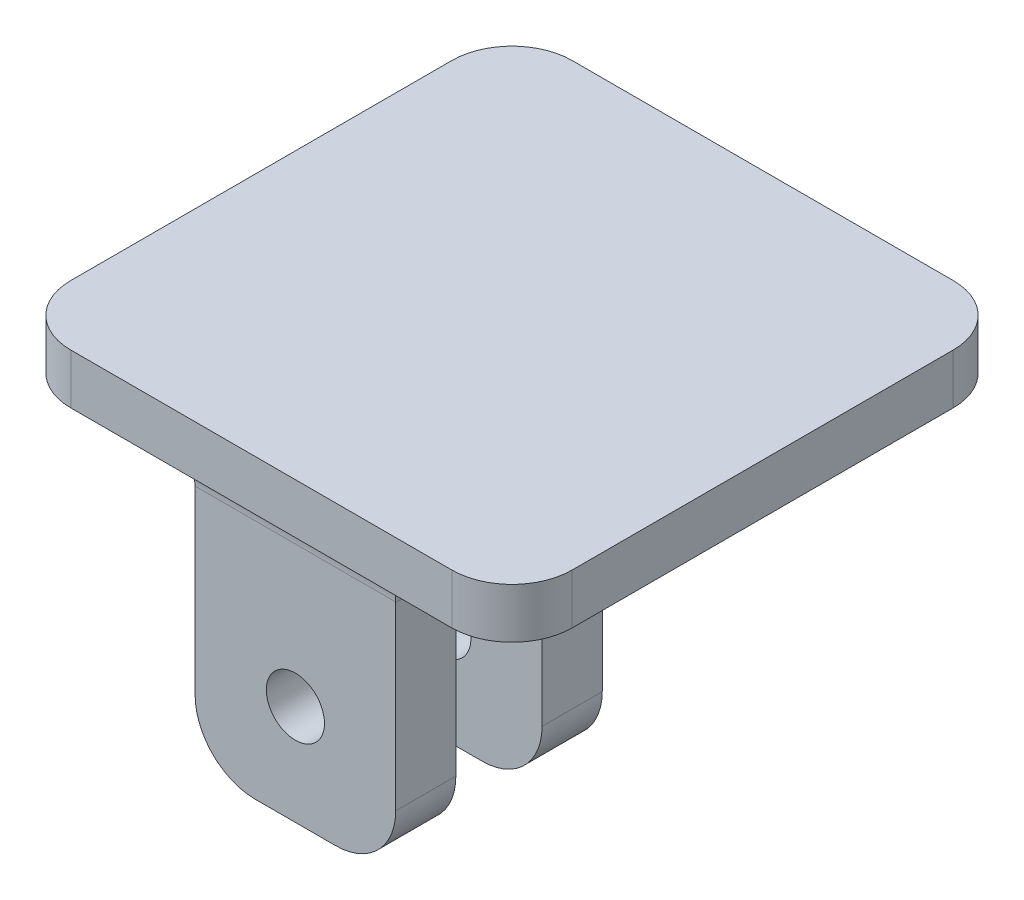
from build123d import *
from build123d.topology import SkipClean

# Parameters (mm, degrees)
SKETCH1_W           = 25
SKETCH1_H           = 25
BOSS_EXTRUDE1_DEPTH = 2.5
SKETCH2_W           = 10
SKETCH2_H           = 10.3
BOSS_EXTRUDE2_DEPTH = 14
SKETCH3_W           = 10
SKETCH3_H           = 4.3
CUT_EXTRUDE1_DEPTH  = 12
SKETCH4_R           = 1.45
CUT_EXTRUDE2_DEPTH  = 37.930881387
FILLET1_R           = 3
FILLET2_R           = 3
FILLET3_START       = -12
FILLET3_DEPTH       = 10.3
FILLET3_START_2     = -19.5000001
FILLET3_2_DEPTH     = 14.0000001
FILLET3_START_3     = -15
FILLET3_3_DEPTH     = 15.00001976


with BuildPart() as part:
    # Sketch1 → Boss-Extrude1 (new body)
    with BuildSketch(Plane(origin=(0, 0, 0), x_dir=(1, 0, 0), z_dir=(0, 1, 0))):
        with Locations((-12.5, 12.5)):
            Rectangle(SKETCH1_W, SKETCH1_H)
    extrude(amount=BOSS_EXTRUDE1_DEPTH)

    # Sketch2 → Boss-Extrude2 (add)
    with BuildSketch(Plane(origin=(0, 0, 0), x_dir=(-1, 0, 0), z_dir=(0, -1, 0))):
        with Locations((12.5, 6.85)):
            Rectangle(SKETCH2_W, SKETCH2_H)
    extrude(amount=BOSS_EXTRUDE2_DEPTH)

    # Sketch3 → Cut-Extrude1 (cut)
    with BuildSketch(Plane(origin=(0, -14, 0), x_dir=(-1, 0, 0), z_dir=(0, -1, 0))):
        with Locations((12.5, 6.85)):
            Rectangle(SKETCH3_W, SKETCH3_H)
    extrude(amount=-CUT_EXTRUDE1_DEPTH, mode=Mode.SUBTRACT)

    # Sketch4 → Cut-Extrude2 (cut, through all)
    with BuildSketch(Plane.XY.offset(-1.7)):
        with Locations((-12.5, -9)):
            Circle(SKETCH4_R)
    extrude(amount=-CUT_EXTRUDE2_DEPTH, mode=Mode.SUBTRACT)

    # Fillet1
    fillet1_edges = [part.edges().sort_by_distance(p)[0] for p in [
        (-17.5, -14, -3.2),
        (-7.5, -14, -10.5),
        (-17.5, -14, -10.5),
        (-7.5, -14, -3.2),
    ]]
    fillet(fillet1_edges, radius=FILLET1_R)

    # Fillet2
    fillet2_edges = [part.edges().sort_by_distance(p)[0] for p in [
        (0, 1.25, 0),
        (-25, 1.25, 0),
        (-25, 1.25, -25),
        (0, 1.25, -25),
    ]]
    fillet(fillet2_edges, radius=FILLET2_R)

    # Fillet3: read off the stored shape, not the designer's step
    # Fillet3 outline → Fillet3 (add)
    with BuildSketch(Plane.XY.offset(FILLET3_START)):
        with BuildLine():
            Line((-7.5, 0), (-7.5, -2))
            ThreePointArc((-7.5, -2), (-6.914213562, -0.585786438), (-5.5, 0))
            Line((-5.5, 0), (-7.5, 0))
        make_face()
        with BuildLine():
            Line((-17.5, -2), (-17.5, 0))
            Line((-17.5, 0), (-19.5, 0))
            ThreePointArc((-19.5, 0), (-18.085786438, -0.585786438), (-17.5, -2))
        make_face()
    extrude(amount=FILLET3_DEPTH)

    # Fillet3 2 outline → Fillet3 2 (add)
    with BuildSketch(Plane.YZ.offset(FILLET3_START_2)):
        with BuildLine():
            Line((0, -1.7), (1.1224e-05, 7.3987e-05))
            ThreePointArc((1.1224e-05, 7.3987e-05), (-0.67350314, -1.216550696), (-1.977371993, -1.7))
            Line((-1.977371993, -1.7), (0, -1.7))
        make_face()
        with BuildLine():
            Line((0, -14), (0, -12))
            Line((0, -12), (-2, -12))
            ThreePointArc((-2, -12), (-0.585786438, -12.585786438), (0, -14))
        make_face()
    extrude(amount=FILLET3_2_DEPTH)

    # Fillet3 3 outline → Fillet3 3 (cut)
    with SkipClean():  # the faces are left unmerged after this step: merging them gives an invalid solid
        with BuildSketch(Plane.XY.offset(FILLET3_START_3)):
            with BuildLine():
                ThreePointArc((-5.5, 0), (-6.914213562, -0.585786438), (-7.5, -2))
                Line((-7.5, -2), (-7.500000001, -3))
                Line((-7.500000001, -3), (-5.5, -3))
                Line((-5.5, -3), (-5.5, -2))
                Line((-5.5, -2), (-5.5, -1.977371993))
                Line((-5.5, -1.977371993), (-5.5, 0))
            make_face()
            with BuildLine():
                Line((-19.5000001, -3), (-17.499999999, -3))
                Line((-17.499999999, -3), (-17.5, -2))
                ThreePointArc((-17.5, -2), (-18.085786438, -0.585786438), (-19.5, 0))
                Line((-19.5, 0), (-19.5000001, -1.977371993))
                Line((-19.5000001, -1.977371993), (-19.5000001, -2))
                Line((-19.5000001, -2), (-19.5000001, -3))
            make_face()
        extrude(amount=FILLET3_3_DEPTH, mode=Mode.SUBTRACT)


solid = part.part
